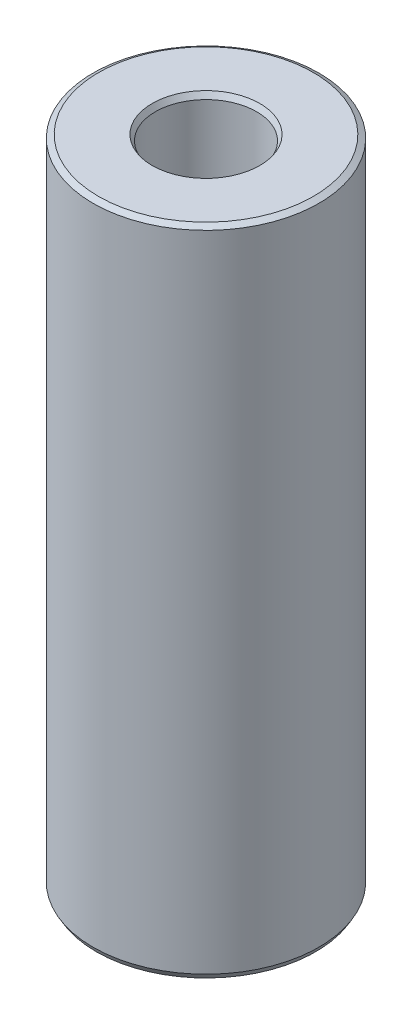
from build123d import *
from OCP.BRepFilletAPI import BRepFilletAPI_MakeChamfer

# Parameters (mm, degrees)
SKETCH1_R           = 40
BOSS_EXTRUDE1_DEPTH = 231.2775658
SKETCH2_R           = 17.925654879
CUT_EXTRUDE1_DEPTH  = 239.095175177
CHAMFER1_SIZE       = 1.132390825
CHAMFER1_SIZE2      = 1.961358444


with BuildPart() as part:
    # Sketch1 → Boss-Extrude1 (new body)
    with BuildSketch(Plane(origin=(0, 0, 0), x_dir=(1, 0, 0), z_dir=(0, 1, 0))):
        Circle(SKETCH1_R)
    extrude(amount=BOSS_EXTRUDE1_DEPTH)

    # Sketch2 → Cut-Extrude1 (cut, through all)
    with BuildSketch(Plane(origin=(0, 0, 0), x_dir=(1, 0, 0), z_dir=(0, 1, 0))):
        Circle(SKETCH2_R)
    extrude(amount=CUT_EXTRUDE1_DEPTH, mode=Mode.SUBTRACT)

    # Chamfer1: one chamfer whose edges measure the first distance from different faces: ONE call of the kernel's chamfer builder (chamfer() names one face for all edges)
    chamfer1_edges_1 = [part.edges().sort_by_distance(p)[0] for p in [
        (-17.925654879, 231.2775658, 0),
    ]]
    chamfer1_side_1 = [part.faces().sort_by_distance(p)[0] for p in [
        (-38.86862915, 231.2775658, 0),
    ]]
    chamfer1_edges_2 = [part.edges().sort_by_distance(p)[0] for p in [
        (-17.925654879, 0, 0),
    ]]
    chamfer1_side_2 = [part.faces().sort_by_distance(p)[0] for p in [
        (-17.925654879, 115.6387829, 0),
    ]]
    chamfer1_edges_3 = [part.edges().sort_by_distance(p)[0] for p in [
        (-40, 0, 0),
    ]]
    chamfer1_side_3 = [part.faces().sort_by_distance(p)[0] for p in [
        (-38.86862915, 0, 0),
    ]]
    chamfer1_edges_4 = [part.edges().sort_by_distance(p)[0] for p in [
        (-40, 231.2775658, 0),
    ]]
    chamfer1_side_4 = [part.faces().sort_by_distance(p)[0] for p in [
        (-40, 115.6387829, 0),
    ]]
    chamfer1 = BRepFilletAPI_MakeChamfer(part.part.solid().wrapped)
    for e in chamfer1_edges_1:
        chamfer1.Add(CHAMFER1_SIZE, CHAMFER1_SIZE2, e.wrapped, chamfer1_side_1[0].wrapped)  # the first distance lies on this face
    for e in chamfer1_edges_2:
        chamfer1.Add(CHAMFER1_SIZE, CHAMFER1_SIZE2, e.wrapped, chamfer1_side_2[0].wrapped)  # the first distance lies on this face
    for e in chamfer1_edges_3:
        chamfer1.Add(CHAMFER1_SIZE, CHAMFER1_SIZE2, e.wrapped, chamfer1_side_3[0].wrapped)  # the first distance lies on this face
    for e in chamfer1_edges_4:
        chamfer1.Add(CHAMFER1_SIZE, CHAMFER1_SIZE2, e.wrapped, chamfer1_side_4[0].wrapped)  # the first distance lies on this face
    add(Compound.cast(chamfer1.Shape()), mode=Mode.REPLACE)


solid = part.part
